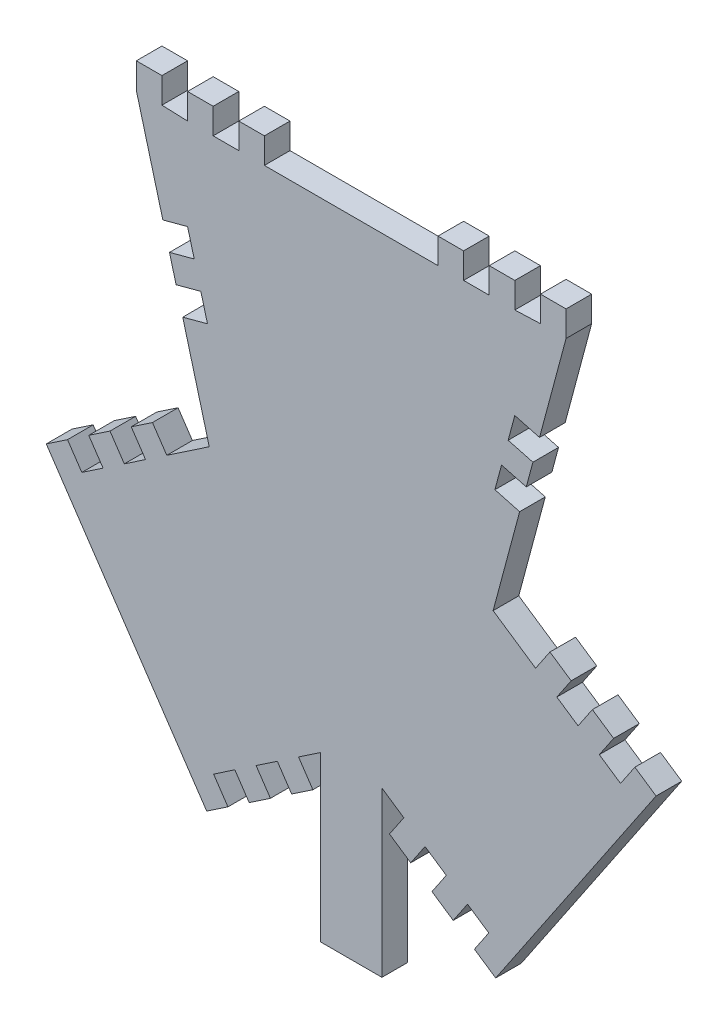
from build123d import *

# Parameters (mm, degrees)
BOSS_EXTRU_1_DEPTH = 5


with BuildPart() as part:
    # Esquisse1 → Boss.-Extru.1 (new body)
    with BuildSketch(Plane.XY):
        Polygon((-88.078571115, 23.97454103), (-84.196285433, 9.485653617), (-82.902190208, 4.656024486), (-91.192565933, -0.935904549), (-93.98853045, 3.209283314), (-98.133718313, 0.413318797), (-95.337753796, -3.731869066), (-99.482941659, -6.527833583), (-102.278906176, -2.382645721), (-106.424094039, -5.178610238), (-103.628129521, -9.323798101), (-107.773317384, -12.119762618), (-110.569281902, -7.974574755), (-114.714469764, -10.770539273), (-83.39966717, -57.196643336), (-79.254479307, -54.400678818), (-82.050443825, -50.255490956), (-77.905255962, -47.459526438), (-75.109291444, -51.604714301), (-70.964103582, -48.808749784), (-73.760068099, -44.663561921), (-69.614880236, -41.867597404), (-66.818915719, -46.012785266), (-62.673727856, -43.216820749), (-65.469692373, -39.071632886), (-61.196285433, -36.189183509), (-61.196285433, -68.189183509), (-49.196285433, -68.189183509), (-49.196285433, -36.189183509), (-44.922878493, -39.071632886), (-47.71884301, -43.216820749), (-43.573655147, -46.012785266), (-40.77769063, -41.867597404), (-36.632502767, -44.663561921), (-39.428467285, -48.808749784), (-35.283279422, -51.604714301), (-32.487314904, -47.459526438), (-28.342127042, -50.255490956), (-31.138091559, -54.400678818), (-26.992903696, -57.196643336), (4.321898898, -10.770539273), (0.176711035, -7.974574755), (-2.619253482, -12.119762618), (-6.764441345, -9.323798101), (-3.968476827, -5.178610238), (-8.11366469, -2.382645721), (-10.909629207, -6.527833583), (-15.05481707, -3.731869066), (-12.258852553, 0.413318797), (-16.404040416, 3.209283314), (-19.200004933, -0.935904549), (-27.490380659, 4.656024486), (-26.196285433, 9.485653617), (-22.313999752, 23.97454103), (-27.143748653, 25.268189187), (-25.849653427, 30.097818318), (-21.019904526, 28.804170162), (-19.725809301, 33.633799293), (-24.555558202, 34.92744745), (-23.261910045, 39.757196351), (-18.432161144, 38.463548194), (-13.255780242, 57.78206472), (-13.255780242, 62.78206472), (-18.255780242, 62.78206472), (-18.255780242, 57.78206472), (-23.252304446, 57.595662248), (-23.252304446, 62.595662248), (-28.252304446, 62.595662248), (-28.252304446, 57.595662248), (-33.252304446, 57.595662248), (-33.252304446, 62.595662248), (-38.252304446, 62.595662248), (-38.252304446, 57.595662248), (-72.14026642, 57.595662248), (-72.14026642, 62.595662248), (-77.14026642, 62.595662248), (-77.14026642, 57.595662248), (-82.14026642, 57.595662248), (-82.14026642, 62.595662248), (-87.14026642, 62.595662248), (-87.14026642, 57.595662248), (-92.136790624, 57.78206472), (-92.136790624, 62.78206472), (-97.136790624, 62.78206472), (-97.136790624, 57.78206472), (-91.960409722, 38.463548194), (-87.130660821, 39.757196351), (-85.837012665, 34.92744745), (-90.666761566, 33.633799293), (-89.37266634, 28.804170162), (-84.542917439, 30.097818318), (-83.248822214, 25.268189187), align=None)
    extrude(amount=BOSS_EXTRU_1_DEPTH)


solid = part.part
